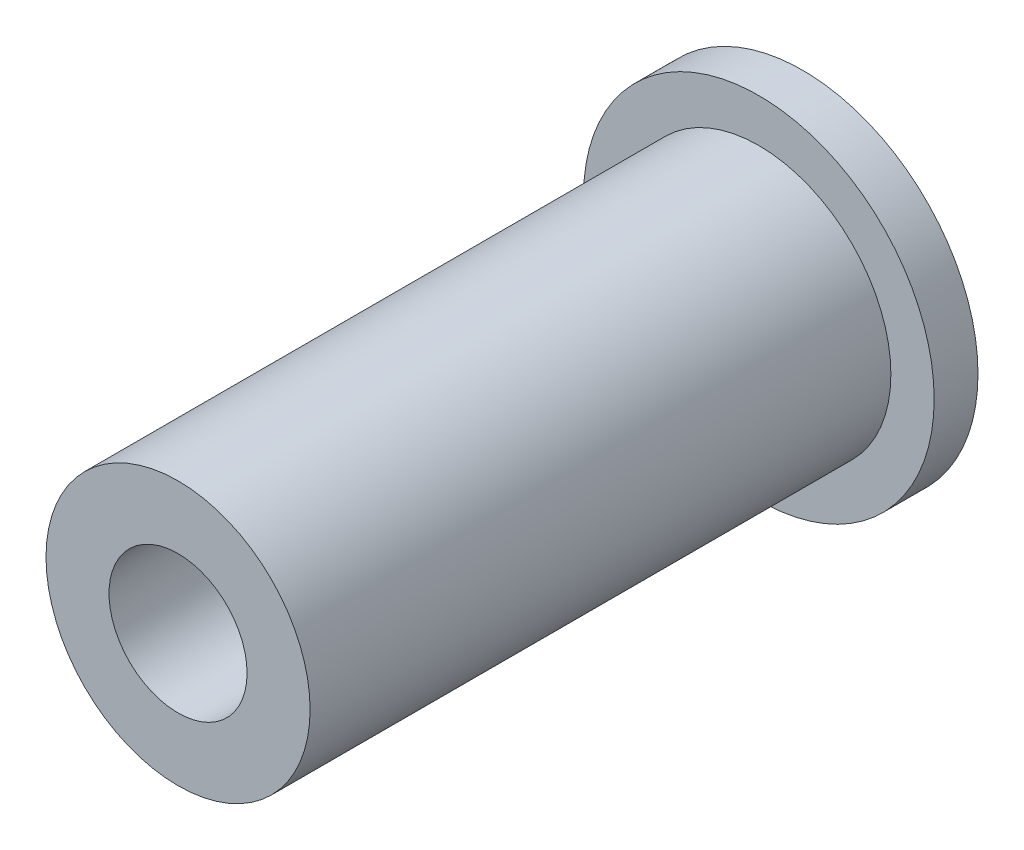
from build123d import *

# Parameters (mm, degrees)
SKETCH1_R           = 6.025
BOSS_EXTRUDE1_DEPTH = 10
CUT_EXTRUDE1_DEPTH  = 10
SKETCH3_R           = 6.025
BOSS_EXTRUDE2_DEPTH = 16.5
SKETCH4_R           = 3.1496
CUT_EXTRUDE2_DEPTH  = 16.5
SKETCH5_R           = 8
BOSS_EXTRUDE3_DEPTH = 2


with BuildPart() as part:
    # Sketch1 → Boss-Extrude1 (new body)
    with BuildSketch(Plane.XY):
        Circle(SKETCH1_R)
    extrude(amount=BOSS_EXTRUDE1_DEPTH)

    # Sketch2 → Cut-Extrude1 (cut)
    with BuildSketch(Plane.XY.offset(10)):
        Polygon((0.7493, 2.839527996), (0, 3.1496), (-0.7493, 2.839527996), (-0.784561281, 1.3589), (-2.084453379, 2.068676833), (-2.727633612, 1.5748), (-2.833753379, 0.770851163), (-1.569122562, 0), (-2.833753379, -0.770851163), (-2.727633612, -1.5748), (-2.084453379, -2.068676833), (-0.784561281, -1.3589), (-0.7493, -2.839527996), (0, -3.1496), (0.7493, -2.839527996), (0.784561281, -1.3589), (2.084453379, -2.068676833), (2.727633612, -1.5748), (2.833753379, -0.770851163), (1.569122562, 0), (2.833753379, 0.770851163), (2.727633612, 1.5748), (2.084453379, 2.068676833), (0.784561281, 1.3589), align=None)
    extrude(amount=-CUT_EXTRUDE1_DEPTH, mode=Mode.SUBTRACT)

    # Sketch3 → Boss-Extrude2 (add)
    with BuildSketch(Plane.XY.offset(10)):
        Circle(SKETCH3_R)
    extrude(amount=BOSS_EXTRUDE2_DEPTH)

    # Sketch4 → Cut-Extrude2 (cut)
    with BuildSketch(Plane.XY.offset(26.5)):
        Circle(SKETCH4_R)
    extrude(amount=-CUT_EXTRUDE2_DEPTH, mode=Mode.SUBTRACT)

    # Sketch5 → Boss-Extrude3 (add)
    with BuildSketch(Plane(origin=(0, 0, 0), x_dir=(-1, 0, 0), z_dir=(0, 0, -1))):
        Circle(SKETCH5_R)
    extrude(amount=BOSS_EXTRUDE3_DEPTH)


solid = part.part
